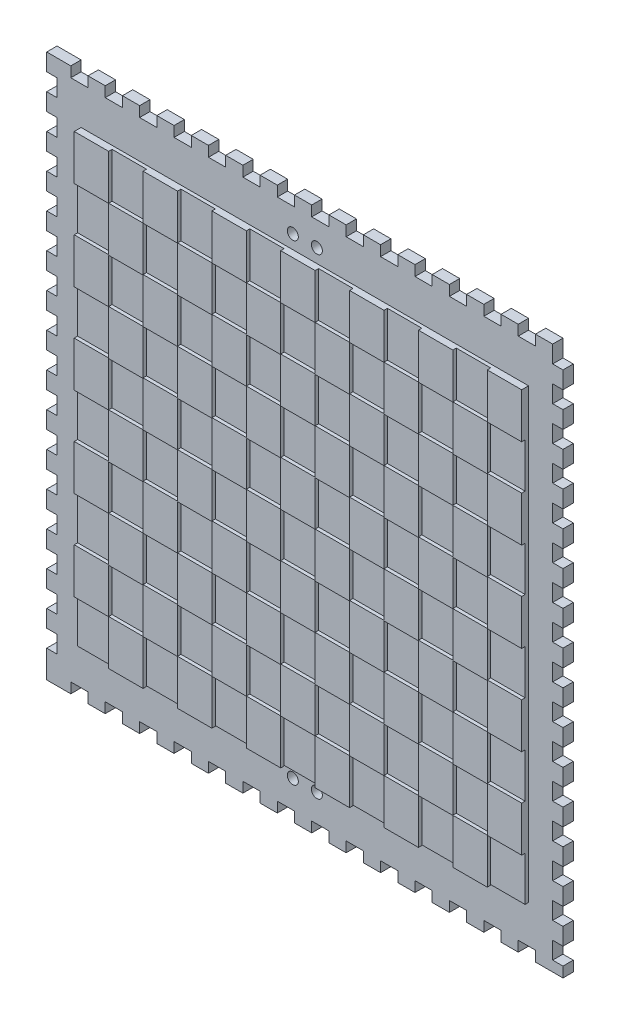
from build123d import *

# Parameters (mm, degrees)
SKETCH1_W            = 150
SKETCH1_H            = 158
BOSS_EXTRUDE1_DEPTH  = 5
SKETCH2_W            = 130
SKETCH2_H            = 130
CUT_EXTRUDE1_DEPTH   = 1
SKETCH3_W            = 10
SKETCH3_H            = 13.1
BOSS_EXTRUDE2_DEPTH  = 1
SKETCH5_W            = 150
SKETCH5_H            = 158
SKETCH5_W_2          = 130
SKETCH5_H_2          = 130
CUT_EXTRUDE6_DEPTH   = 2
LPATTERN3_COUNT      = 7
LPATTERN3_PITCH      = 20
LPATTERN3_COUNT_DIR2 = 5
LPATTERN3_PITCH_DIR2 = 26
SKETCH11_W           = 10
SKETCH11_H           = 13.1
BOSS_EXTRUDE4_DEPTH  = 1
LPATTERN4_COUNT      = 6
LPATTERN4_PITCH      = 20
LPATTERN4_COUNT_DIR2 = 5
LPATTERN4_PITCH_DIR2 = 26
SKETCH12_W           = 3
SKETCH12_H           = 5
CUT_EXTRUDE10_DEPTH  = 109.972473589
LPATTERN5_COUNT      = 16
LPATTERN5_PITCH      = 10
SKETCH13_W           = 5
SKETCH13_H           = 3
CUT_EXTRUDE11_DEPTH  = 3
LPATTERN6_COUNT      = 14
LPATTERN6_PITCH      = 10
SKETCH14_W           = 5
SKETCH14_H           = 3
CUT_EXTRUDE12_DEPTH  = 3
LPATTERN7_COUNT      = 14
LPATTERN7_PITCH      = 10
SKETCH15_W           = 3
SKETCH15_H           = 5
CUT_EXTRUDE13_DEPTH  = 10
LPATTERN8_COUNT      = 15
LPATTERN8_PITCH      = 10
SKETCH16_R           = 1.6
CUT_EXTRUDE14_DEPTH  = 15
SKETCH17_R           = 1.6
CUT_EXTRUDE15_DEPTH  = 10


with BuildPart() as part:
    # Sketch1 → Boss-Extrude1 (new body)
    with BuildSketch(Plane.XY):
        Rectangle(SKETCH1_W, SKETCH1_H)
    extrude(amount=BOSS_EXTRUDE1_DEPTH)

    # Sketch2 → Cut-Extrude1 (cut)
    with BuildSketch(Plane.XY.offset(5)):
        Rectangle(SKETCH2_W, SKETCH2_H)
    extrude(amount=-CUT_EXTRUDE1_DEPTH, mode=Mode.SUBTRACT)

    # Sketch3 → Boss-Extrude2 (add)
    with BuildSketch(Plane.XY.offset(4)):
        with Locations((-60, 58.45)):
            Rectangle(SKETCH3_W, SKETCH3_H)
    boss_extrude2 = extrude(amount=BOSS_EXTRUDE2_DEPTH)

    # Sketch5 → Cut-Extrude6 (cut)
    with BuildSketch(Plane.XY.offset(5)):
        Rectangle(SKETCH5_W, SKETCH5_H)
        Rectangle(SKETCH5_W_2, SKETCH5_H_2, mode=Mode.SUBTRACT)
    extrude(amount=-CUT_EXTRUDE6_DEPTH, mode=Mode.SUBTRACT)

    # LPattern3: Boss-Extrude2 7 × 5
    with Locations(*[(i * LPATTERN3_PITCH, -j * LPATTERN3_PITCH_DIR2, 0) for i in range(LPATTERN3_COUNT) for j in range(LPATTERN3_COUNT_DIR2) if (i, j) != (0, 0)]):
        add(boss_extrude2)

    # Sketch11 → Boss-Extrude4 (add)
    with BuildSketch(Plane.XY.offset(4)):
        with Locations((-50, 45.4)):
            Rectangle(SKETCH11_W, SKETCH11_H)
    boss_extrude4 = extrude(amount=BOSS_EXTRUDE4_DEPTH)

    # LPattern4: Boss-Extrude4 6 × 5
    with Locations(*[(i * LPATTERN4_PITCH, -j * LPATTERN4_PITCH_DIR2, 0) for i in range(LPATTERN4_COUNT) for j in range(LPATTERN4_COUNT_DIR2) if (i, j) != (0, 0)]):
        add(boss_extrude4)

    # Sketch12 → Cut-Extrude10 (cut, through all)
    with BuildSketch(Plane.XY.offset(3)):
        with Locations((73.5, 76.5)):
            Rectangle(SKETCH12_W, SKETCH12_H)
    cut_extrude10 = extrude(amount=-CUT_EXTRUDE10_DEPTH, mode=Mode.SUBTRACT)

    # LPattern5: Cut-Extrude10 ×16
    with Locations(*[(0, -i * LPATTERN5_PITCH, 0) for i in range(1, LPATTERN5_COUNT)]):
        add(cut_extrude10, mode=Mode.SUBTRACT)

    # Sketch13 → Cut-Extrude11 (cut)
    with BuildSketch(Plane.XY.offset(3)):
        with Locations((64.5, 77.5)):
            Rectangle(SKETCH13_W, SKETCH13_H)
    cut_extrude11 = extrude(amount=-CUT_EXTRUDE11_DEPTH, mode=Mode.SUBTRACT)

    # LPattern6: Cut-Extrude11 ×14
    with Locations(*[(-i * LPATTERN6_PITCH, 0, 0) for i in range(1, LPATTERN6_COUNT)]):
        add(cut_extrude11, mode=Mode.SUBTRACT)

    # Sketch14 → Cut-Extrude12 (cut)
    with BuildSketch(Plane.XY.offset(3)):
        with Locations((64.5, -77.5)):
            Rectangle(SKETCH14_W, SKETCH14_H)
    cut_extrude12 = extrude(amount=-CUT_EXTRUDE12_DEPTH, mode=Mode.SUBTRACT)

    # LPattern7: Cut-Extrude12 ×14
    with Locations(*[(-i * LPATTERN7_PITCH, 0, 0) for i in range(1, LPATTERN7_COUNT)]):
        add(cut_extrude12, mode=Mode.SUBTRACT)

    # Sketch15 → Cut-Extrude13 (cut)
    with BuildSketch(Plane.XY.offset(3)):
        with Locations((-73.5, 71.5)):
            Rectangle(SKETCH15_W, SKETCH15_H)
    cut_extrude13 = extrude(amount=-CUT_EXTRUDE13_DEPTH, mode=Mode.SUBTRACT)

    # LPattern8: Cut-Extrude13 ×15
    with Locations(*[(0, -i * LPATTERN8_PITCH, 0) for i in range(1, LPATTERN8_COUNT)]):
        add(cut_extrude13, mode=Mode.SUBTRACT)

    # Sketch16 → Cut-Extrude14 (cut)
    with BuildSketch(Plane.XY.offset(3)):
        with Locations((-3.5, 69)):
            Circle(SKETCH16_R)
        with Locations((3.5, 69)):
            Circle(SKETCH16_R)
    extrude(amount=-CUT_EXTRUDE14_DEPTH, mode=Mode.SUBTRACT)

    # Sketch17 → Cut-Extrude15 (cut)
    with BuildSketch(Plane.XY.offset(3)):
        with Locations((3.5, -68)):
            Circle(SKETCH17_R)
        with Locations((-3.5, -68)):
            Circle(SKETCH17_R)
    extrude(amount=-CUT_EXTRUDE15_DEPTH, mode=Mode.SUBTRACT)


solid = part.part
